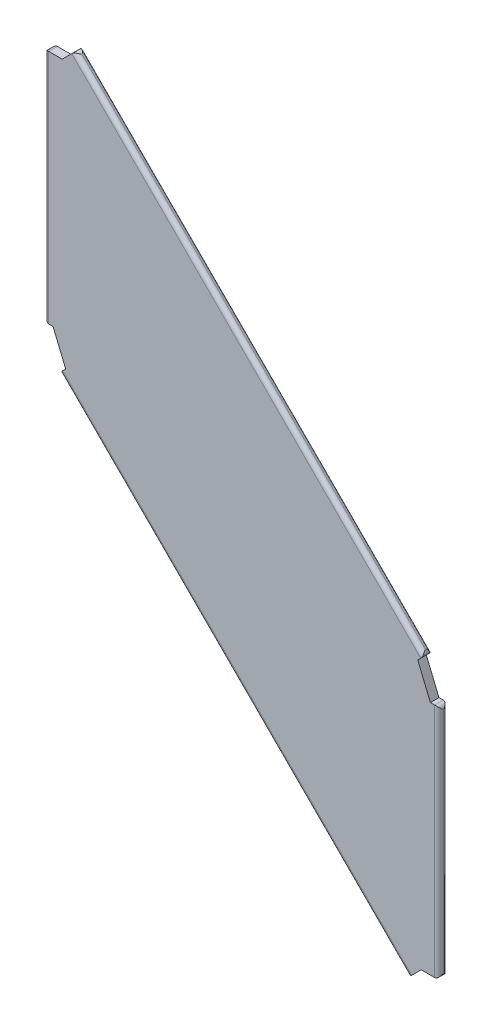
from build123d import *

# Parameters (mm, degrees)
EXTRUDE_1_DEPTH = 0.2
FILLET_1_R      = 0.1


with BuildPart() as part:
    # 草图1 → 凸台-拉伸1 (new body)
    with BuildSketch(Plane.XY):
        Polygon((0, -6), (0, -0.5), (-0.2, -0.5), (-0.494974747, 0.212132034), (-0.353553391, 0.353553391), (-8.485281374, 8.485281374), (-8.778174593, 8.192388155), (-9.192388155, 8.192388155), (-9.192388155, 2.692388155), (-8.992388155, 2.692388155), (-8.697413409, 1.980256121), (-8.838834765, 1.838834765), (-0.707106781, -6.292893219), (-0.414213562, -6), align=None)
    extrude(amount=EXTRUDE_1_DEPTH)

    # 圆角1
    fillet_1_edges = [part.edges().sort_by_distance(p)[0] for p in [
        (-9.192388155, 5.442388155, 0),
        (-4.419417382, 4.419417382, 0),
        (-4.772970773, -2.227029227, 0.2),
        (0, -3.25, 0),
        (-4.772970773, -2.227029227, 0),
        (-9.192388155, 2.692388155, 0.1),
        (-9.192388155, 8.192388155, 0.1),
        (-8.485281374, 8.485281374, 0.1),
        (-0.353553391, 0.353553391, 0.1),
        (0, -0.5, 0.1),
        (0, -6, 0.1),
        (-0.707106781, -6.292893219, 0.1),
        (-8.838834765, 1.838834765, 0.1),
        (0, -3.25, 0.2),
        (-4.419417382, 4.419417382, 0.2),
        (-9.192388155, 5.442388155, 0.2),
    ]]
    fillet(fillet_1_edges, radius=FILLET_1_R - 0.0001)  # a hair under: the kernel refuses the full size


solid = part.part
